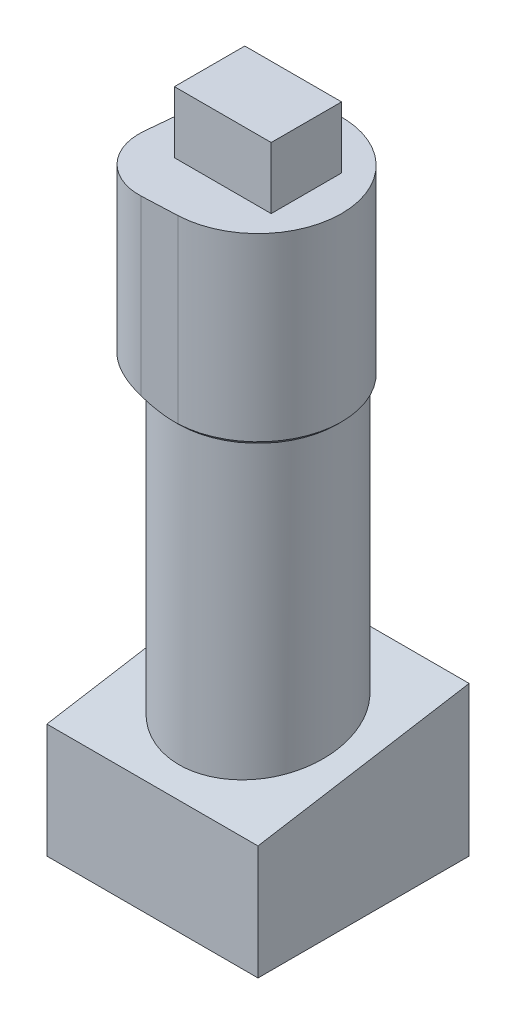
from build123d import *

# Parameters (mm, degrees)
SKETCH1_W           = 24
SKETCH1_H           = 24
BOSS_EXTRUDE1_DEPTH = 17
CUT_EXTRUDE1_DEPTH  = 32.764760349
SKETCH3_R           = 9
BOSS_EXTRUDE2_DEPTH = 52
BOSS_EXTRUDE3_DEPTH = 16
CHAMFER1_START      = 46.9999999
CHAMFER1_OUTLINE_R  = 9
CHAMFER1_DEPTH      = 5.0000001
SKETCH5_W           = 11
SKETCH5_H           = 8
BOSS_EXTRUDE4_DEPTH = 7
SKETCH6_R           = 2.05
CUT_EXTRUDE2_DEPTH  = 6


with BuildPart() as part:
    # Sketch1 → Boss-Extrude1 (new body)
    with BuildSketch(Plane(origin=(0, 0, 0), x_dir=(1, 0, 0), z_dir=(0, 1, 0))):
        Rectangle(SKETCH1_W, SKETCH1_H)
    extrude(amount=BOSS_EXTRUDE1_DEPTH)

    # Sketch2 → Cut-Extrude1 (cut, through all)
    with BuildSketch(Plane.ZY.offset(12)):
        Polygon((-12, 17), (12, 13), (12, 17), align=None)
    extrude(amount=-CUT_EXTRUDE1_DEPTH, mode=Mode.SUBTRACT)

    # Sketch3 → Boss-Extrude2 (add)
    with BuildSketch(Plane.XZ):
        with Locations(Location((0, 0, 0), (0, 0, 270))):
            Circle(SKETCH3_R)
    extrude(amount=-BOSS_EXTRUDE2_DEPTH)

    # Sketch4 → Boss-Extrude3 (add)
    with BuildSketch(Plane(origin=(0, 52, 0), x_dir=(1, 0, 0), z_dir=(0, 1, 0))):
        with BuildLine():
            Line((-9.456572951, 0.90731914), (-9.84083402, -3.097658461))
            ThreePointArc((-9.84083402, -3.097658461), (-8.220587121, -7.800746053), (-3.608813676, -9.665090067))
            Line((-3.608813676, -9.665090067), (0.410792593, -9.491114236))
            ThreePointArc((0.410792593, -9.491114236), (6.891182028, 6.539236214), (-9.456572951, 0.90731914))
        make_face()
    extrude(amount=BOSS_EXTRUDE3_DEPTH)

    # Chamfer1: read off the stored shape, not the designer's step
    # Chamfer1 outline → Chamfer1 (add)
    with BuildSketch(Plane(origin=(0, 0, 0), x_dir=(1, 0, 0), z_dir=(0, 1, 0)).offset(CHAMFER1_START)):
        with BuildLine():
            ThreePointArc((-9.84083402, -3.097658461), (-8.220587121, -7.800746053), (-3.608813676, -9.665090067))
            Line((-3.608813676, -9.665090067), (0.410792593, -9.491114236))
            ThreePointArc((0.410792593, -9.491114236), (6.891182028, 6.539236214), (-9.456572951, 0.90731914))
            Line((-9.456572951, 0.90731914), (-9.84083402, -3.097658461))
        make_face()
        Circle(CHAMFER1_OUTLINE_R, mode=Mode.SUBTRACT)
    extrude(amount=CHAMFER1_DEPTH)

    # Chamfer1 2 outline → Chamfer1 2 (revolve, cut)
    with BuildSketch(Plane.XY):
        Polygon((11.332682454, 49.332682454), (9, 47), (11.332682454, 46.9999999), align=None)
    revolve(axis=Axis((0, 0, 0), (0, 1, 0)), mode=Mode.SUBTRACT)

    # Sketch5 → Boss-Extrude4 (add)
    with BuildSketch(Plane(origin=(0, 68, 0), x_dir=(1, 0, 0), z_dir=(0, 1, 0))):
        Rectangle(SKETCH5_W, SKETCH5_H)
    extrude(amount=BOSS_EXTRUDE4_DEPTH)

    # Sketch6 → Cut-Extrude2 (cut)
    with BuildSketch(Plane(origin=(0, 0, -12), x_dir=(-1, 0, 0), z_dir=(0, 0, -1))):
        with Locations((5, 12)):
            Circle(SKETCH6_R)
        with Locations((-5, 12)):
            Circle(SKETCH6_R)
    extrude(amount=-CUT_EXTRUDE2_DEPTH, mode=Mode.SUBTRACT)


solid = part.part
